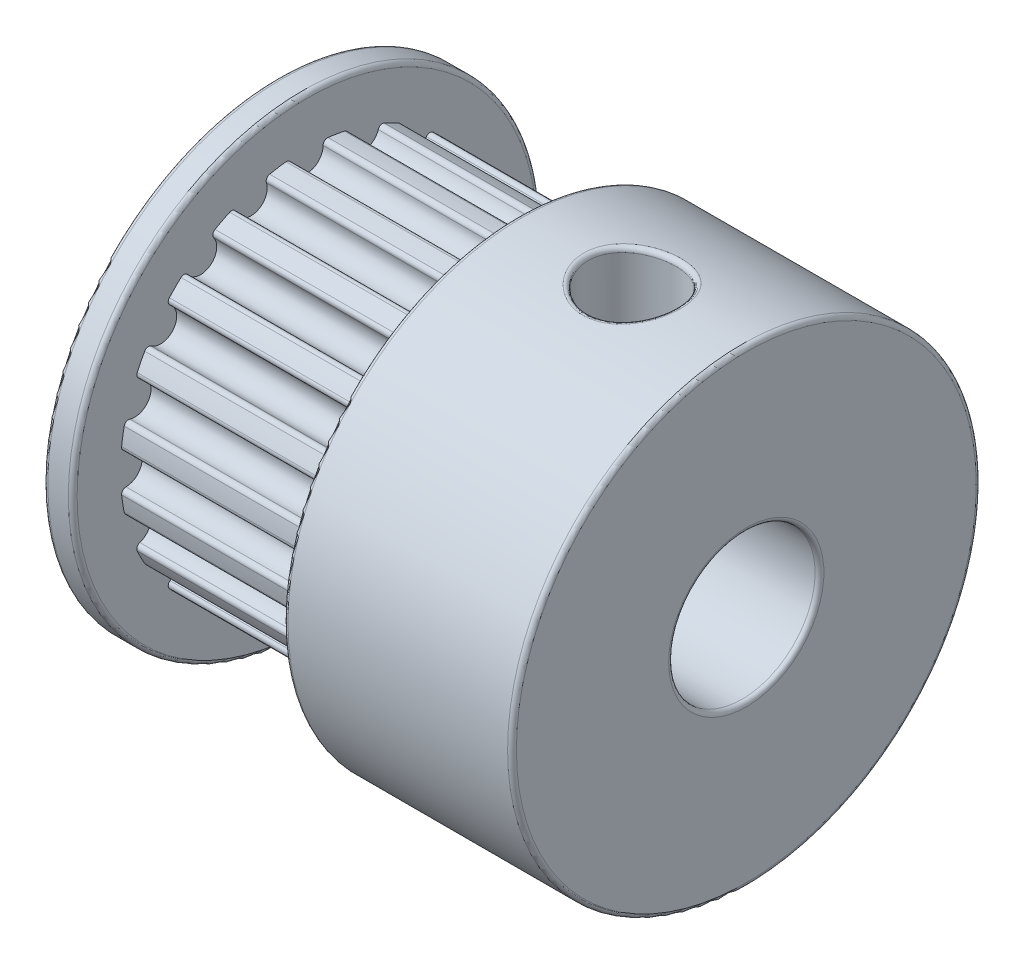
from build123d import *

# Parameters (mm, degrees)
CUT_EXTRUDE1_DEPTH       = 7.2
FILLET1_R                = 0.15
CIRPATTERN1_COUNT        = 20
FILLET1_OF_CIRPATTERN1_R = 0.15
FILLET2_R                = 0.15
SKETCH3_R                = 1.5
CUT_EXTRUDE2_DEPTH       = 7.2
FILLET3_R                = 0.15
FILLET4_R                = 0.15


with BuildPart() as part:
    # Sketch1 → Revolve1 (revolve)
    with BuildSketch(Plane.XY):
        Polygon((0, 8), (1, 8), (1, 6.37), (8.2, 6.37), (8.2, 8), (16, 8), (16, 2.5), (0, 2.5), align=None)
    revolve(axis=Axis((0, 0, 0), (1, 0, 0)))

    # Sketch2 → Cut-Extrude1 (cut)
    with BuildSketch(Plane.ZY.offset(-8.2)):
        with BuildLine():
            ThreePointArc((0.523570189, 6.348446602), (0, 6.37), (-0.523570189, 6.348446602))
            ThreePointArc((-0.523570189, 6.348446602), (0, 5.63), (0.523570189, 6.348446602))
        make_face()
    cut_extrude1 = extrude(amount=CUT_EXTRUDE1_DEPTH, mode=Mode.SUBTRACT)

    # Fillet1
    fillet1_edges = [part.edges().sort_by_distance(p)[0] for p in [
        (4.6, 6.348446602, 0.523570189),
        (4.6, 6.348446602, -0.523570189),
    ]]
    fillet(fillet1_edges, radius=FILLET1_R)

    # CirPattern1: Cut-Extrude1 ×20 about axis
    cirpattern1_axis = Axis((0, 0, 0), (-1, 0, 0))
    for i in range(1, CIRPATTERN1_COUNT):
        add(cut_extrude1.rotate(cirpattern1_axis, i * 360 / CIRPATTERN1_COUNT), mode=Mode.SUBTRACT)

    # Fillet1 of CirPattern1
    fillet1_of_cirpattern1_edges = [part.edges().sort_by_distance(p)[0] for p in [
        (4.6, 6.199523595, -1.463833048),
        (4.6, 5.875939423, -2.459722727),
        (4.6, 5.443748024, -3.307946107),
        (4.6, 4.828254354, -4.155100468),
        (4.6, 4.155100468, -4.828254354),
        (4.6, 3.307946107, -5.443748024),
        (4.6, 2.459722727, -5.875939423),
        (4.6, 1.463833048, -6.199523595),
        (4.6, 0.523570189, -6.348446602),
        (4.6, -0.523570189, -6.348446602),
        (4.6, -1.463833048, -6.199523595),
        (4.6, -2.459722727, -5.875939423),
        (4.6, -3.307946107, -5.443748024),
        (4.6, -4.155100468, -4.828254354),
        (4.6, -4.828254354, -4.155100468),
        (4.6, -5.443748024, -3.307946107),
        (4.6, -5.875939423, -2.459722727),
        (4.6, -6.199523595, -1.463833048),
        (4.6, -6.348446602, -0.523570189),
        (4.6, -6.348446602, 0.523570189),
        (4.6, -6.199523595, 1.463833048),
        (4.6, -5.875939423, 2.459722727),
        (4.6, -5.443748024, 3.307946107),
        (4.6, -4.828254354, 4.155100468),
        (4.6, -4.155100468, 4.828254354),
        (4.6, -3.307946107, 5.443748024),
        (4.6, -2.459722727, 5.875939423),
        (4.6, -1.463833048, 6.199523595),
        (4.6, -0.523570189, 6.348446602),
        (4.6, 0.523570189, 6.348446602),
        (4.6, 1.463833048, 6.199523595),
        (4.6, 2.459722727, 5.875939423),
        (4.6, 3.307946107, 5.443748024),
        (4.6, 4.155100468, 4.828254354),
        (4.6, 4.828254354, 4.155100468),
        (4.6, 5.443748024, 3.307946107),
        (4.6, 5.875939423, 2.459722727),
        (4.6, 6.199523595, 1.463833048),
    ]]
    fillet(fillet1_of_cirpattern1_edges, radius=FILLET1_OF_CIRPATTERN1_R)

    # Fillet2
    fillet2_edges = [part.edges().sort_by_distance(p)[0] for p in [
        (0, -2.5, 0),
        (16, -8, 0),
        (8.2, -8, 0),
        (1, -8, 0),
        (0, -8, 0),
    ]]
    fillet(fillet2_edges, radius=FILLET2_R)

    # Sketch3 → Cut-Extrude2 (cut)
    with BuildSketch(Plane(origin=(0, 8, 0), x_dir=(1, 0, 0), z_dir=(0, 1, 0))):
        with Locations((12.1, 0)):
            Circle(SKETCH3_R)
    extrude(amount=-CUT_EXTRUDE2_DEPTH, mode=Mode.SUBTRACT)

    # Fillet3
    fillet3_edges = [part.edges().sort_by_distance(p)[0] for p in [
        (12.1, 7.858116823, -1.5),
    ]]
    fillet(fillet3_edges, radius=FILLET3_R)

    # Fillet4
    fillet4_edges = [part.edges().sort_by_distance(p)[0] for p in [
        (16, -2.5, 0),
    ]]
    fillet(fillet4_edges, radius=FILLET4_R)


solid = part.part
